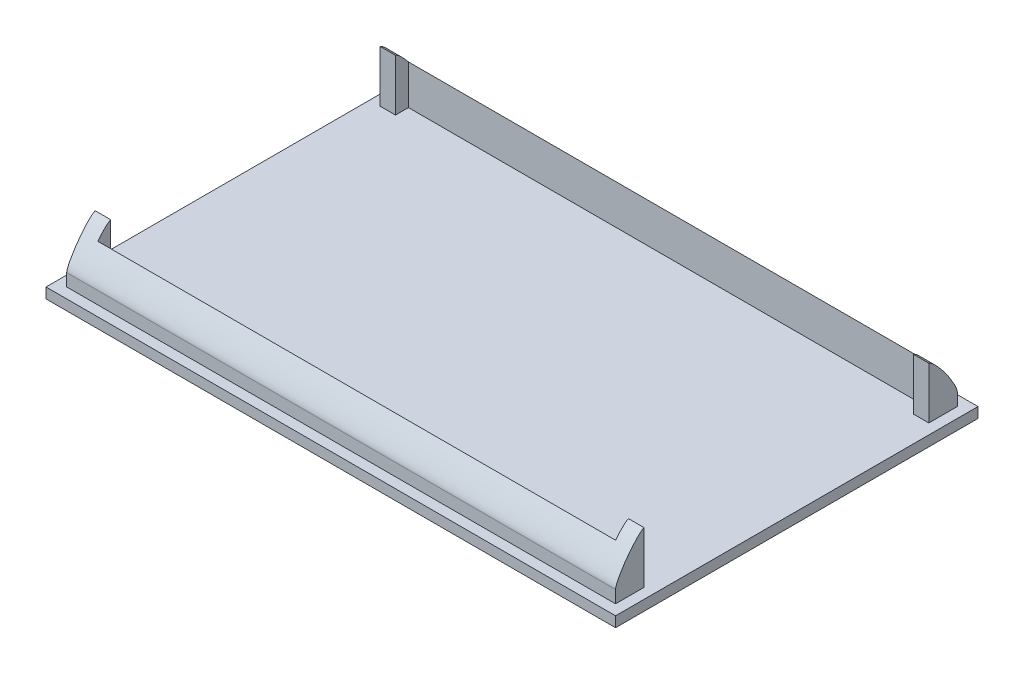
from build123d import *

# Parameters (mm, degrees)
CROQUIS1_W              = 110
CROQUIS1_H              = 70
SALIENTE_EXTRUIR1_DEPTH = 2
CROQUIS2_W              = 106
CROQUIS2_H              = 66
CROQUIS2_W_2            = 100
CROQUIS2_H_2            = 60
SALIENTE_EXTRUIR2_DEPTH = 10
CROQUIS3_W              = 110
CROQUIS3_H              = 55
CORTAR_EXTRUIR1_DEPTH   = 10
REDONDEO1_START         = -53
REDONDEO1_DEPTH         = 106


with BuildPart() as part:
    # Croquis1 → Saliente-Extruir1 (new body)
    with BuildSketch(Plane(origin=(0, 0, 0), x_dir=(1, 0, 0), z_dir=(0, 1, 0))):
        Rectangle(CROQUIS1_W, CROQUIS1_H)
    extrude(amount=SALIENTE_EXTRUIR1_DEPTH)

    # Croquis2 → Saliente-Extruir2 (add)
    with BuildSketch(Plane(origin=(0, 2, 0), x_dir=(1, 0, 0), z_dir=(0, 1, 0))):
        Rectangle(CROQUIS2_W, CROQUIS2_H)
        Rectangle(CROQUIS2_W_2, CROQUIS2_H_2, mode=Mode.SUBTRACT)
    extrude(amount=SALIENTE_EXTRUIR2_DEPTH)

    # Croquis3 → Cortar-Extruir1 (cut)
    with BuildSketch(Plane(origin=(0, 12, 0), x_dir=(1, 0, 0), z_dir=(0, 1, 0))):
        Rectangle(CROQUIS3_W, CROQUIS3_H)
    extrude(amount=-CORTAR_EXTRUIR1_DEPTH, mode=Mode.SUBTRACT)

    # Redondeo1: read off the stored shape, not the designer's step
    # Redondeo1 outline → Redondeo1 (cut)
    with BuildSketch(Plane.YZ.offset(REDONDEO1_START)):
        with BuildLine():
            Line((4.400657923, -33), (12, -33))
            Line((12, -33), (12, -27.5))
            add(Edge.make_bspline(
                [(12, -27.5), (11.925717186, -27.725800205), (11.717980707, -28.062974077), (11.294012734, -28.57513658), (10.552168001, -29.267993446), (8.343872585, -31.051001592), (6.627785298, -32.237452301), (5.39060754, -32.810235795), (4.741950411, -33), (4.400657923, -33)],
                knots=[0.589454173, 0.589454173, 0.589454173, 0.589454173, 0.589454173, 0.589454173, 1, 1, 1, 1, 1.589454173, 1.589454173, 1.589454173, 1.589454173, 1.589454173, 1.589454173], degree=5, weights=[1, 1, 1.007998589, 1.001618266, 1, 1, 0.973408773, 1.007044093, 1, 1]))
        make_face()
        with BuildLine():
            Line((12, 33), (4.400657923, 33))
            add(Edge.make_bspline(
                [(4.400657923, 33), (4.741950411, 33), (5.39060754, 32.810235795), (6.627785298, 32.237452301), (8.343872585, 31.051001592), (10.552168001, 29.267993446), (11.294012734, 28.57513658), (11.717980707, 28.062974077), (11.925717186, 27.725800205), (12, 27.5)],
                knots=[0, 0, 0, 0, 0, 0, 0.589454173, 0.589454173, 0.589454173, 0.589454173, 1, 1, 1, 1, 1, 1], degree=5, weights=[1, 1, 1.007044093, 0.973408773, 1, 1, 1.001618266, 1.007998589, 1, 1]))
            Line((12, 27.5), (12, 33))
        make_face()
    extrude(amount=REDONDEO1_DEPTH, mode=Mode.SUBTRACT)


solid = part.part
